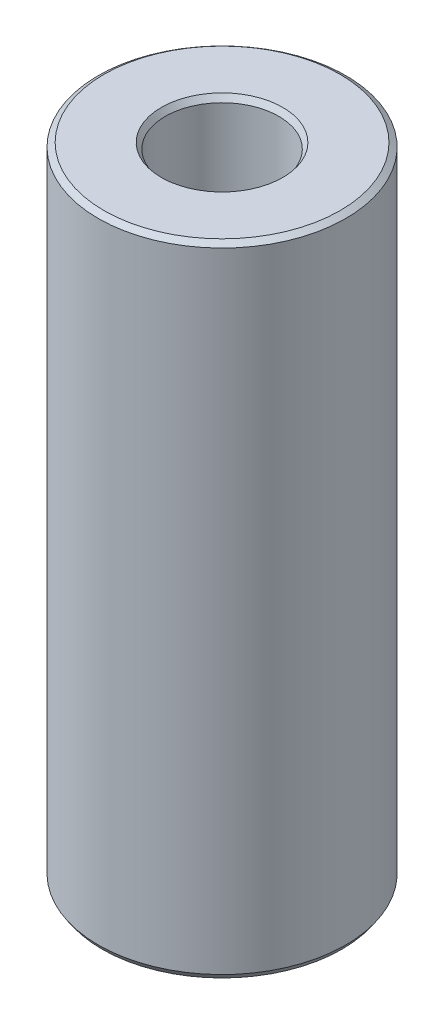
from build123d import *
from OCP.BRepFilletAPI import BRepFilletAPI_MakeChamfer

# Parameters (mm, degrees)
SKETCH1_R           = 50
BOSS_EXTRUDE1_DEPTH = 258.032303414
SKETCH2_R           = 22.936548782
CUT_EXTRUDE1_DEPTH  = 268.545640228
CHAMFER1_SIZE       = 1.595241705
CHAMFER1_SIZE2      = 2.322422108


with BuildPart() as part:
    # Sketch1 → Boss-Extrude1 (new body)
    with BuildSketch(Plane(origin=(0, 0, 0), x_dir=(1, 0, 0), z_dir=(0, 1, 0))):
        Circle(SKETCH1_R)
    extrude(amount=BOSS_EXTRUDE1_DEPTH)

    # Sketch2 → Cut-Extrude1 (cut, through all)
    with BuildSketch(Plane(origin=(0, 0, 0), x_dir=(1, 0, 0), z_dir=(0, 1, 0))):
        Circle(SKETCH2_R)
    extrude(amount=CUT_EXTRUDE1_DEPTH, mode=Mode.SUBTRACT)

    # Chamfer1: one chamfer whose edges measure the first distance from different faces: ONE call of the kernel's chamfer builder (chamfer() names one face for all edges)
    chamfer1_edges_1 = [part.edges().sort_by_distance(p)[0] for p in [
        (-22.936548782, 258.032303414, 0),
    ]]
    chamfer1_side_1 = [part.faces().sort_by_distance(p)[0] for p in [
        (-48.585786438, 258.032303414, 0),
    ]]
    chamfer1_edges_2 = [part.edges().sort_by_distance(p)[0] for p in [
        (-22.936548782, 0, 0),
    ]]
    chamfer1_side_2 = [part.faces().sort_by_distance(p)[0] for p in [
        (-22.936548782, 129.016151707, 0),
    ]]
    chamfer1_edges_3 = [part.edges().sort_by_distance(p)[0] for p in [
        (-50, 0, 0),
    ]]
    chamfer1_side_3 = [part.faces().sort_by_distance(p)[0] for p in [
        (-48.585786438, 0, 0),
    ]]
    chamfer1_edges_4 = [part.edges().sort_by_distance(p)[0] for p in [
        (-50, 258.032303414, 0),
    ]]
    chamfer1_side_4 = [part.faces().sort_by_distance(p)[0] for p in [
        (-50, 129.016151707, 0),
    ]]
    chamfer1 = BRepFilletAPI_MakeChamfer(part.part.solid().wrapped)
    for e in chamfer1_edges_1:
        chamfer1.Add(CHAMFER1_SIZE, CHAMFER1_SIZE2, e.wrapped, chamfer1_side_1[0].wrapped)  # the first distance lies on this face
    for e in chamfer1_edges_2:
        chamfer1.Add(CHAMFER1_SIZE, CHAMFER1_SIZE2, e.wrapped, chamfer1_side_2[0].wrapped)  # the first distance lies on this face
    for e in chamfer1_edges_3:
        chamfer1.Add(CHAMFER1_SIZE, CHAMFER1_SIZE2, e.wrapped, chamfer1_side_3[0].wrapped)  # the first distance lies on this face
    for e in chamfer1_edges_4:
        chamfer1.Add(CHAMFER1_SIZE, CHAMFER1_SIZE2, e.wrapped, chamfer1_side_4[0].wrapped)  # the first distance lies on this face
    add(Compound.cast(chamfer1.Shape()), mode=Mode.REPLACE)


solid = part.part
